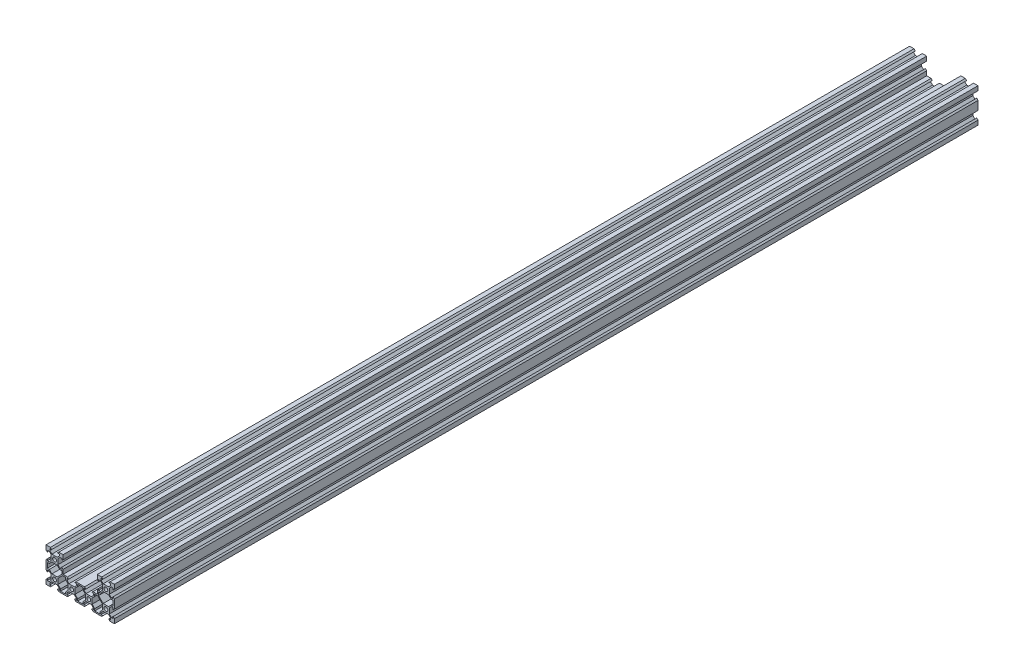
from build123d import *

# Parameters (mm, degrees)
SKETCH2_R           = 2.25
BOSS_EXTRUDE1_DEPTH = 1010


with BuildPart() as part:
    # Sketch2 → Boss-Extrude1 (new body)
    with BuildSketch(Plane.XY):
        Polygon((-5.125, -10), (5.125, -10), (6.625, -8.5), (4.5, -8.5), (4.5, -6.383883476), (6.883883476, -4), (13.116116524, -4), (15.5, -6.383883476), (15.5, -8.5), (13.375, -8.5), (14.875, -10), (25.125, -10), (26.625, -8.5), (24.5, -8.5), (24.5, -6.383883476), (26.883883476, -4), (33.116116524, -4), (35.5, -6.383883476), (35.5, -8.5), (33.375, -8.5), (34.875, -10), (40, -10), (40, -4.875), (38.5, -3.375), (38.5, -5.5), (36.383883476, -5.5), (34, -3.116116524), (34, 3.116116524), (36.383883476, 5.5), (38.5, 5.5), (38.5, 3.375), (40, 4.875), (40, 15.125), (38.5, 16.625), (38.5, 14.5), (36.383883476, 14.5), (34, 16.883883476), (34, 23.116116524), (36.383883476, 25.5), (38.5, 25.5), (38.5, 23.375), (40, 24.875), (40, 30), (34.875, 30), (33.375, 28.5), (35.5, 28.5), (35.5, 26.383883476), (33.116116524, 24), (26.883883476, 24), (24.5, 26.383883476), (24.5, 28.5), (26.625, 28.5), (25.125, 30), (20, 30), (20, 24.875), (21.5, 23.375), (21.5, 25.5), (23.616116524, 25.5), (26, 23.116116524), (26, 16.883883476), (23.616116524, 14.5), (21.5, 14.5), (21.5, 16.625), (20, 15.125), (20, 10), (14.875, 10), (13.375, 8.5), (15.5, 8.5), (15.5, 6.383883476), (13.116116524, 4), (6.883883476, 4), (4.5, 6.383883476), (4.5, 8.5), (6.625, 8.5), (5.125, 10), (-5.125, 10), (-6.625, 8.5), (-4.5, 8.5), (-4.5, 6.383883476), (-6.883883476, 4), (-13.116116524, 4), (-15.5, 6.383883476), (-15.5, 8.5), (-13.375, 8.5), (-14.875, 10), (-20, 10), (-20, 15.125), (-21.5, 16.625), (-21.5, 14.5), (-23.616116524, 14.5), (-26, 16.883883476), (-26, 23.116116524), (-23.616116524, 25.5), (-21.5, 25.5), (-21.5, 23.375), (-20, 24.875), (-20, 30), (-25.125, 30), (-26.625, 28.5), (-24.5, 28.5), (-24.5, 26.383883476), (-26.883883476, 24), (-33.116116524, 24), (-35.5, 26.383883476), (-35.5, 28.5), (-33.375, 28.5), (-34.875, 30), (-40, 30), (-40, 24.875), (-38.5, 23.375), (-38.5, 25.5), (-36.383883476, 25.5), (-34, 23.116116524), (-34, 16.883883476), (-36.383883476, 14.5), (-38.5, 14.5), (-38.5, 16.625), (-40, 15.125), (-40, 4.875), (-38.5, 3.375), (-38.5, 5.5), (-36.383883476, 5.5), (-34, 3.116116524), (-34, -3.116116524), (-36.383883476, -5.5), (-38.5, -5.5), (-38.5, -3.375), (-40, -4.875), (-40, -10), (-34.875, -10), (-33.375, -8.5), (-35.5, -8.5), (-35.5, -6.383883476), (-33.116116524, -4), (-26.883883476, -4), (-24.5, -6.383883476), (-24.5, -8.5), (-26.625, -8.5), (-25.125, -10), (-14.875, -10), (-13.375, -8.5), (-15.5, -8.5), (-15.5, -6.383883476), (-13.116116524, -4), (-6.883883476, -4), (-4.5, -6.383883476), (-4.5, -8.5), (-6.625, -8.5), align=None)
        Polygon((-3, -6.116116524), (-6, -3.116116524), (-6, 3.116116524), (-3, 6.116116524), (-3, 8.5), (3, 8.5), (3, 6.116116524), (6, 3.116116524), (6, -3.116116524), (3, -6.116116524), (3, -8.5), (-3, -8.5), align=None, mode=Mode.SUBTRACT)
        Polygon((-14, 3.116116524), (-14, -3.116116524), (-17, -6.116116524), (-17, -8.5), (-23, -8.5), (-23, -6.116116524), (-26, -3.116116524), (-26, 3.109045456), (-20.609045456, 8.5), (-17, 8.5), (-17, 6.116116524), align=None, mode=Mode.SUBTRACT)
        with Locations((-10, 0)):
            Circle(SKETCH2_R, mode=Mode.SUBTRACT)
        with Locations((10, 0)):
            Circle(SKETCH2_R, mode=Mode.SUBTRACT)
        Polygon((14, -3.116116524), (14, 3.116116524), (17, 6.116116524), (17, 8.5), (20.609045456, 8.5), (26, 3.109045456), (26, -3.116116524), (23, -6.116116524), (23, -8.5), (17, -8.5), (17, -6.116116524), align=None, mode=Mode.SUBTRACT)
        Polygon((-21.5, 9.390954544), (-26.890954544, 4), (-33.116116524, 4), (-36.116116524, 7), (-38.5, 7), (-38.5, 13), (-36.116116524, 13), (-33.116116524, 16), (-26.883883476, 16), (-23.883883476, 13), (-21.5, 13), align=None, mode=Mode.SUBTRACT)
        Polygon((23.883883476, 13), (26.883883476, 16), (33.116116524, 16), (36.116116524, 13), (38.5, 13), (38.5, 7), (36.116116524, 7), (33.116116524, 4), (26.890954544, 4), (21.5, 9.390954544), (21.5, 13), align=None, mode=Mode.SUBTRACT)
        with Locations((-30, 0)):
            Circle(SKETCH2_R, mode=Mode.SUBTRACT)
        with Locations((-30, 20)):
            Circle(SKETCH2_R, mode=Mode.SUBTRACT)
        with Locations((30, 20)):
            Circle(SKETCH2_R, mode=Mode.SUBTRACT)
        with Locations((30, 0)):
            Circle(SKETCH2_R, mode=Mode.SUBTRACT)
    extrude(amount=BOSS_EXTRUDE1_DEPTH)


solid = part.part
